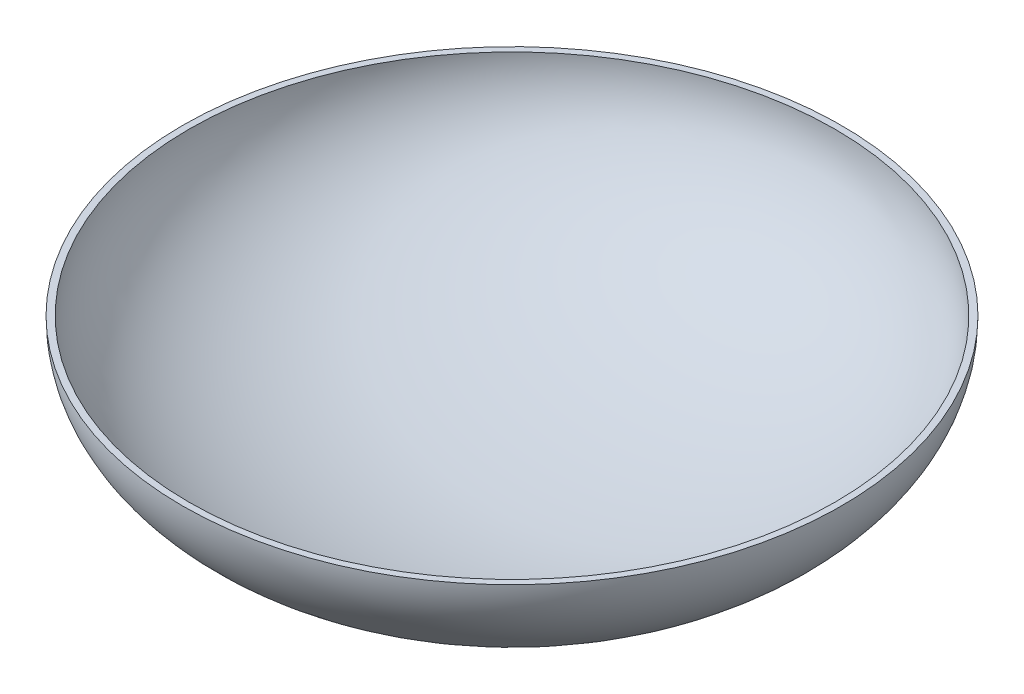
from build123d import *


with BuildPart() as part:
    # Sketch1 → Revolve1 (revolve)
    with BuildSketch(Plane.XY):
        with BuildLine():
            Line((-127, -1.867667778), (-129.54, -1.867667778))
            add(Edge.make_bspline(
                [(-129.54, -1.867667778), (-129.54, -67.907667778), (0, -67.907667778)],
                knots=[3.141592654, 3.141592654, 3.141592654, 4.71238898, 4.71238898, 4.71238898], degree=2, weights=[1, 0.707106781, 1]))
            Line((0, -67.907667778), (0, -65.367667778))
            add(Edge.make_bspline(
                [(-127, -1.867667778), (-127, -65.367667778), (0, -65.367667778)],
                knots=[3.141592654, 3.141592654, 3.141592654, 4.71238898, 4.71238898, 4.71238898], degree=2, weights=[1, 0.707106781, 1]))
        make_face()
    revolve(axis=Axis((0, -65.367667778, 0), (0, -1, 0)))


solid = part.part
